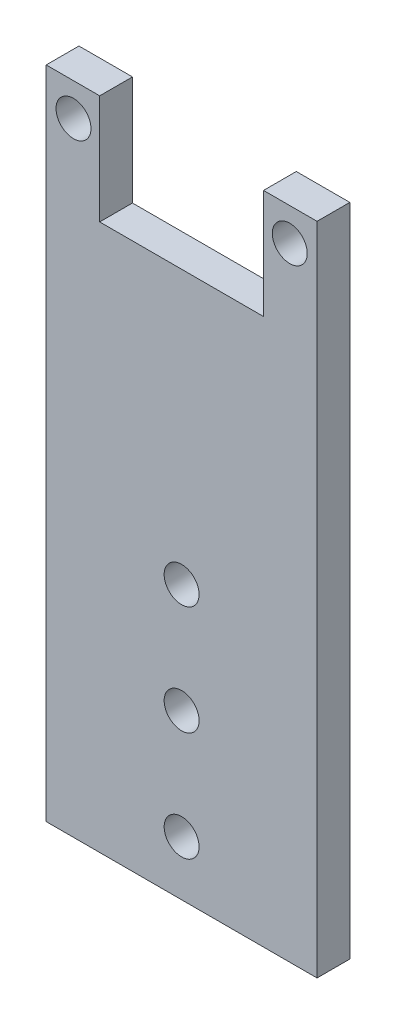
from build123d import *

# Parameters (mm, degrees)
SKETCH1_R  = 1.6
MAIN_DEPTH = 3


with BuildPart() as part:
    # Sketch1 → Main (new body)
    with BuildSketch(Plane.XY):
        Polygon((-7.5, 10), (-7.5, 0), (7.5, 0), (7.5, 10), (12.4, 10), (12.4, -50), (-12.4, -50), (-12.4, 10), align=None)
        with Locations((-9.9, 7)):
            Circle(SKETCH1_R, mode=Mode.SUBTRACT)
        with Locations((9.9, 7)):
            Circle(SKETCH1_R, mode=Mode.SUBTRACT)
        with Locations((0, -25)):
            Circle(SKETCH1_R, mode=Mode.SUBTRACT)
        with Locations((0, -35)):
            Circle(SKETCH1_R, mode=Mode.SUBTRACT)
        with Locations((0, -45)):
            Circle(SKETCH1_R, mode=Mode.SUBTRACT)
    extrude(amount=MAIN_DEPTH)


solid = part.part
